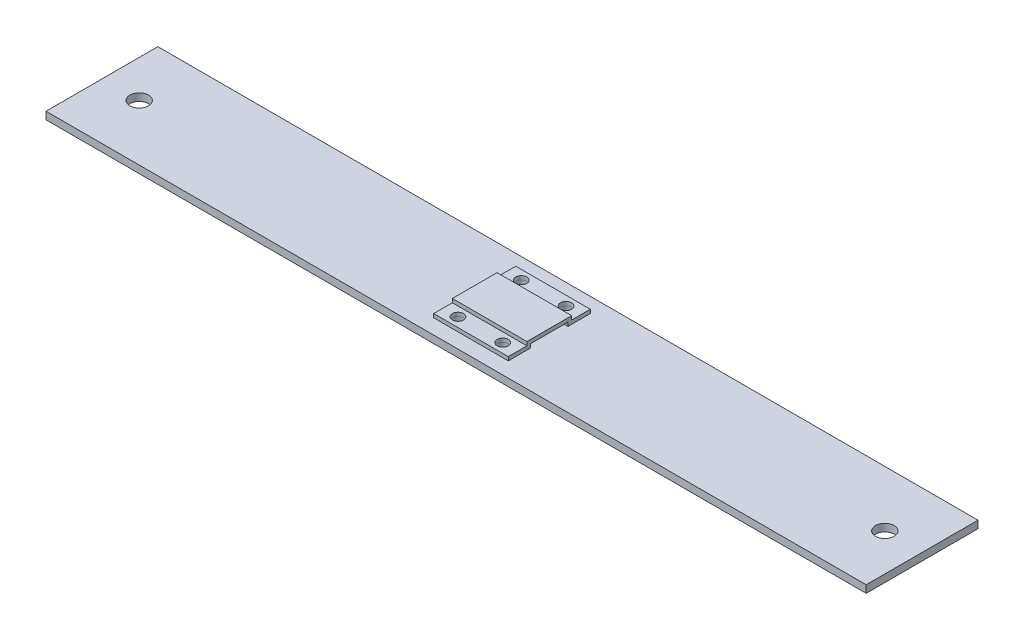
from build123d import *

# Parameters (mm, degrees)
SKETCH_1_W          = 220
SKETCH_1_H          = 30
EXTRUDE_1_DEPTH     = 2
EXTRUDE_START       = -10
EXTRUDE_1_2_DEPTH   = 20
SKETCH_3_R          = 1.5
CUT_EXTRUDE_1_DEPTH = 3
SKETCH_4_R          = 2.5
CUT_EXTRUDE_2_DEPTH = 2


# Read off the part's stored shape, not the designer's step: 拉伸-薄壁1, 分割1
with BuildPart() as part:
    # 草图1 → Extrude 1 (new body)
    with BuildSketch(Plane(origin=(0, 0, 0), x_dir=(1, 0, 0), z_dir=(0, 1, 0))):
        Rectangle(SKETCH_1_W, SKETCH_1_H)
    extrude(amount=EXTRUDE_1_DEPTH)

    # Extrude 1 2 outline → Extrude 1 2 (add)
    with BuildSketch(Plane(origin=(0, 0, 0), x_dir=(0, 0, -1), z_dir=(1, 0, 0)).offset(EXTRUDE_START)):
        Polygon((-11, 3), (-11, 2), (-5, 2), (-5, 3), (5, 3), (5, 2), (11, 2), (11, 3), (6, 3), (6, 4), (-6, 4), (-6, 3), align=None)
    extrude(amount=EXTRUDE_1_2_DEPTH)

    # 草图3 → 切除-拉伸1 (cut)
    with BuildSketch(Plane(origin=(0, 3, 0), x_dir=(1, 0, 0), z_dir=(0, 1, 0))):
        with Locations(Location((-6, 8.5, 0), (0, 0, 270))):
            Circle(SKETCH_3_R)
        with Locations(Location((6, 8.5, 0), (0, 0, 270))):
            Circle(SKETCH_3_R)
        with Locations(Location((-6, -8.5, 0), (0, 0, 270))):
            Circle(SKETCH_3_R)
        with Locations(Location((6, -8.5, 0), (0, 0, 270))):
            Circle(SKETCH_3_R)
    extrude(amount=-CUT_EXTRUDE_1_DEPTH, mode=Mode.SUBTRACT)


with BuildPart() as body_2:
    # Split Bodies 1: the piece on the far side of the plane
    add(part.part)
    split(bisect_by=Plane(origin=(0, 2, 0), x_dir=(1, 0, 0), z_dir=(0, 1, 0)), keep=Keep.BOTTOM)

    # 草图4 → 切除-拉伸2 (cut)
    with BuildSketch(Plane(origin=(0, 2, 0), x_dir=(1, 0, 0), z_dir=(0, 1, 0))):
        with Locations(Location((-100, 0, 0), (0, 0, 270))):
            Circle(SKETCH_4_R)
        with Locations(Location((100, 0, 0), (0, 0, 270))):
            Circle(SKETCH_4_R)
    extrude(amount=-CUT_EXTRUDE_2_DEPTH, mode=Mode.SUBTRACT)


with BuildPart() as part_1:
    add(part.part)

    # Split Bodies 1
    split(bisect_by=Plane(origin=(0, 2, 0), x_dir=(1, 0, 0), z_dir=(0, 1, 0)), keep=Keep.TOP)


solid = Compound([body_2.part, part_1.part])
